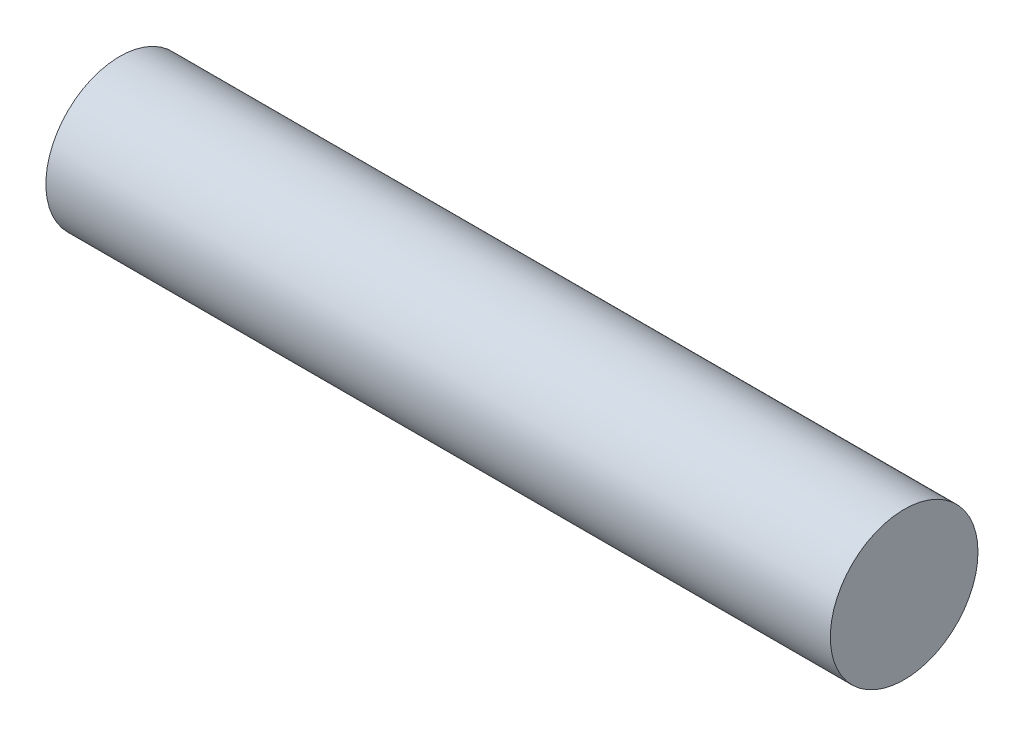
from build123d import *

# Parameters (mm, degrees)
SKETCH1_R          = 80
FOAMBODY_DEPTH     = 425
BATTERY_START      = 10
SKETCH2_W          = 165
SKETCH2_H          = 60
BATTERY_BAY_DEPTH  = 60
FOAM_START         = 10
SKETCH3_W          = 150
SKETCH3_H          = 80
FOAM_DEPTH         = 35
BATTERY_DEPTH      = 3
BATTERY_DEPTH_BACK = 47
SKETCH4_W          = 155
SKETCH4_H          = 48
FC_START           = 13
SKETCH5_W          = 52
SKETCH5_H          = 32
FC_DEPTH           = 17


with BuildPart() as part:
    # Sketch1 → FoamBody (new, symmetric)
    with BuildSketch(Plane(origin=(0, 0, 0), x_dir=(0, 0, -1), z_dir=(1, 0, 0))):
        Circle(SKETCH1_R)
    extrude(amount=FOAMBODY_DEPTH, both=True)

    # Sketch2 → battery bay (cut)
    with BuildSketch(Plane(origin=(0, 0, 0), x_dir=(1, 0, 0), z_dir=(0, 1, 0)).offset(BATTERY_START)):
        with Locations((-261, 0)):
            Rectangle(SKETCH2_W, SKETCH2_H)
    extrude(amount=-BATTERY_BAY_DEPTH, mode=Mode.SUBTRACT)

    # Sketch3 → Foam (cut)
    with BuildSketch(Plane(origin=(0, 0, 0), x_dir=(1, 0, 0), z_dir=(0, 1, 0)).offset(FOAM_START)):
        with Locations((-225, 0)):
            Rectangle(SKETCH3_W, SKETCH3_H)
    extrude(amount=FOAM_DEPTH, mode=Mode.SUBTRACT)


with BuildPart() as body_2:
    # Sketch4 → Battery (new, two sides: drawn at the far end of the back side and taken through both)
    with BuildSketch(Plane(origin=(0, 0, 0), x_dir=(1, 0, 0), z_dir=(0, 1, 0)).offset(-BATTERY_DEPTH_BACK)):
        with Locations((-261, 0)):
            Rectangle(SKETCH4_W, SKETCH4_H)
    extrude(amount=BATTERY_DEPTH + BATTERY_DEPTH_BACK)


with BuildPart() as body_3:
    # Sketch5 → FC (new body)
    with BuildSketch(Plane(origin=(0, 0, 0), x_dir=(1, 0, 0), z_dir=(0, 1, 0)).offset(FC_START)):
        with Locations((-225, 0)):
            Rectangle(SKETCH5_W, SKETCH5_H)
    extrude(amount=FC_DEPTH)


solid = Compound([part.part, body_2.part, body_3.part])
